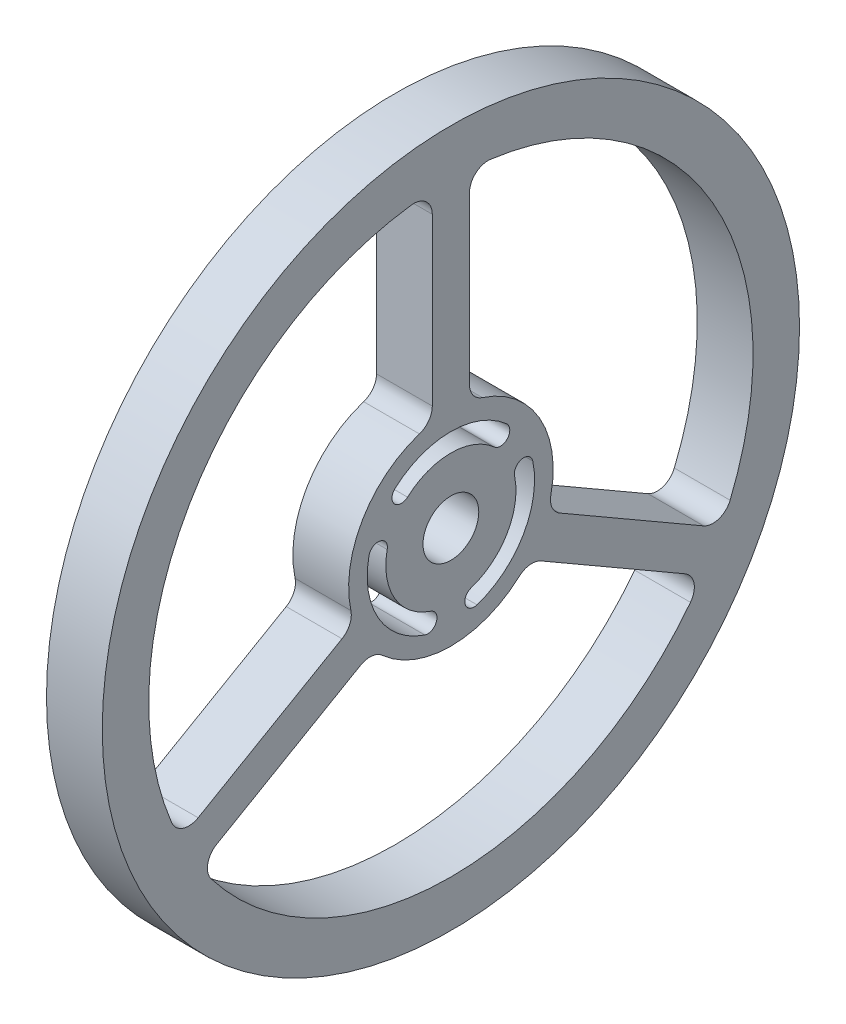
from build123d import *

# Parameters (mm, degrees)
SKETCH1_R           = 37.5
SKETCH1_R_2         = 3
BOSS_EXTRUDE1_DEPTH = 6
FILLET1_R           = 2
CUT_EXTRUDE1_DEPTH  = 10
CIRPATTERN1_COUNT   = 3


with BuildPart() as part:
    # Sketch1 → Boss-Extrude1 (new body)
    with BuildSketch(Plane(origin=(0, 0, 0), x_dir=(0, 0, -1), z_dir=(1, 0, 0))):
        Circle(SKETCH1_R)
        with BuildLine():
            Line((2, 10.816653826), (2, 32.438403167))
            ThreePointArc((2, 32.438403167), (28.145825623, 16.25), (29.0924812, -14.487150776))
            Line((29.0924812, -14.487150776), (10.367496998, -3.676276106))
            ThreePointArc((10.367496998, -3.676276106), (9.526279442, 5.5), (2, 10.816653826))
        make_face(mode=Mode.SUBTRACT)
        with BuildLine():
            ThreePointArc((-8.367496998, -7.140377721), (0, -11), (8.367496998, -7.140377721))
            Line((8.367496998, -7.140377721), (27.0924812, -17.951252391))
            ThreePointArc((27.0924812, -17.951252391), (0, -32.5), (-27.0924812, -17.951252391))
            Line((-27.0924812, -17.951252391), (-8.367496998, -7.140377721))
        make_face(mode=Mode.SUBTRACT)
        with BuildLine():
            ThreePointArc((-2, 10.816653826), (-9.526279442, 5.5), (-10.367496998, -3.676276106))
            Line((-10.367496998, -3.676276106), (-29.0924812, -14.487150776))
            ThreePointArc((-29.0924812, -14.487150776), (-28.145825623, 16.25), (-2, 32.438403167))
            Line((-2, 32.438403167), (-2, 10.816653826))
        make_face(mode=Mode.SUBTRACT)
        Circle(SKETCH1_R_2, mode=Mode.SUBTRACT)
    extrude(amount=BOSS_EXTRUDE1_DEPTH)

    # Fillet1
    fillet1_edges = [part.edges().sort_by_distance(p)[0] for p in [
        (3, -3.676276106, 10.367496998),
        (3, -7.140377721, 8.367496998),
        (3, -7.140377721, -8.367496998),
        (3, -3.676276106, -10.367496998),
        (3, 10.816653826, -2),
        (3, -17.951252391, -27.0924812),
        (3, -14.487150776, -29.0924812),
        (3, -17.951252391, 27.0924812),
        (3, -14.487150776, 29.0924812),
        (3, 32.438403167, -2),
        (3, 32.438403167, 2),
        (3, 10.816653826, 2),
    ]]
    fillet(fillet1_edges, radius=FILLET1_R)

    # Sketch2 → Cut-Extrude1 (cut)
    with BuildSketch(Plane(origin=(6, 0, 0), x_dir=(0, 0, -1), z_dir=(1, 0, 0))):
        with BuildLine():
            ThreePointArc((6, 6.708203932), (0, 9), (-6, 6.708203932))
            ThreePointArc((-6, 6.708203932), (-6.078689326, 5.296181273), (-4.666666667, 5.217491947))
            ThreePointArc((-4.666666667, 5.217491947), (0, 7), (4.666666667, 5.217491947))
            ThreePointArc((4.666666667, 5.217491947), (6.078689326, 5.296181273), (6, 6.708203932))
        make_face()
    cut_extrude1 = extrude(amount=-CUT_EXTRUDE1_DEPTH, mode=Mode.SUBTRACT)

    # CirPattern1: Cut-Extrude1 ×3 about axis
    cirpattern1_axis = Axis((6, 0, 0), (1, 0, 0))
    for i in range(1, CIRPATTERN1_COUNT):
        add(cut_extrude1.rotate(cirpattern1_axis, i * 360 / CIRPATTERN1_COUNT), mode=Mode.SUBTRACT)


solid = part.part
